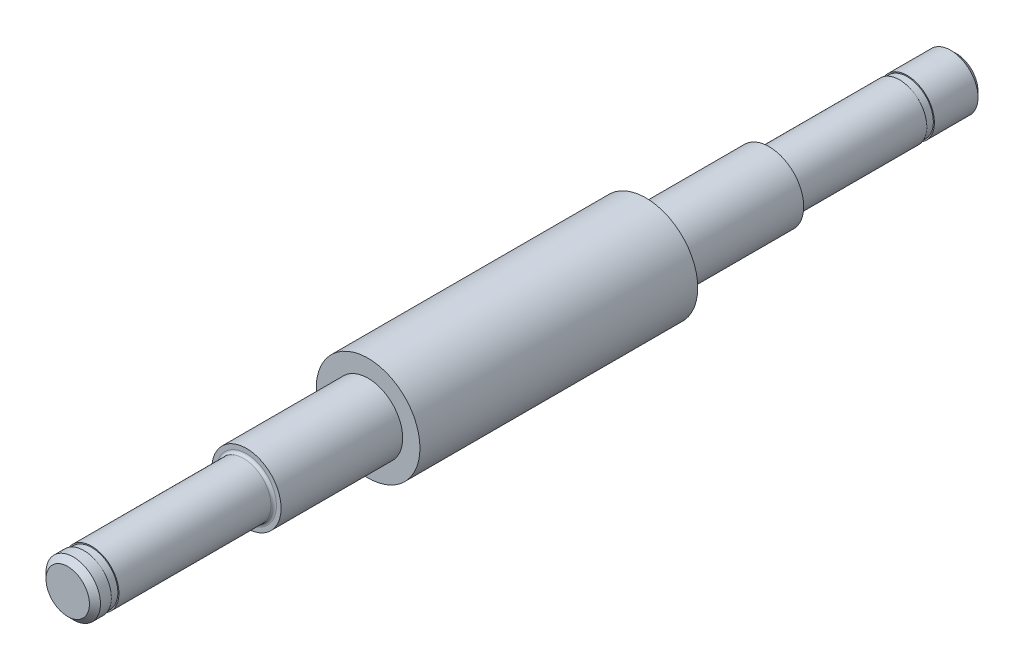
from build123d import *

# Parameters (mm, degrees)
SKETCH1_R                = 2.5
BOSS_EXTRUDE1_DEPTH      = 40.767
SKETCH2_W                = 0.7
SKETCH2_H                = 0.1
SKETCH5_R                = 3.175
BOSS_EXTRUDE3_DEPTH      = 47.9552
SKETCH7_W                = 0.7
SKETCH7_H                = 0.1
CHAMFER1_SIZE            = 0.508
FILLET1_R                = 0.254
BOSS_EXTRUDE4_DEPTH      = 13.208
BOSS_EXTRUDE4_DEPTH_BACK = 12.2809
SKETCH8_R                = 4.7625


with BuildPart() as part:
    # Sketch1 → Boss-Extrude1 (new, symmetric)
    with BuildSketch(Plane.XY):
        Circle(SKETCH1_R)
    extrude(amount=BOSS_EXTRUDE1_DEPTH, both=True)

    # Sketch2 → Cut-Revolve1 (revolve, cut)
    with BuildSketch(Plane(origin=(0, 0, 0), x_dir=(0, 0, -1), z_dir=(1, 0, 0))):
        with Locations((-38.914555436, 2.45)):
            Rectangle(SKETCH2_W, SKETCH2_H)
    revolve(axis=Axis((0, 0, 40.767), (0, 0, -1)), mode=Mode.SUBTRACT)

    # Sketch5 → Boss-Extrude3 (add)
    with BuildSketch(Plane(origin=(0, 0, 24.364555436), x_dir=(-1, 0, 0), z_dir=(0, 0, -1))):
        Circle(SKETCH5_R)
    extrude(amount=BOSS_EXTRUDE3_DEPTH)

    # Sketch7 → Cut-Revolve2 (revolve, cut)
    with BuildSketch(Plane(origin=(0, -92.71594082, 0), x_dir=(0, 0, 1), z_dir=(1, 0, 0))):
        with Locations((-35.912002714, -95.16594082)):
            Rectangle(SKETCH7_W, SKETCH7_H)
    revolve(axis=Axis((0, 0, -23.590644564), (0, 0, -1)), mode=Mode.SUBTRACT)

    # Chamfer1
    chamfer1_edges = [part.edges().sort_by_distance(p)[0] for p in [
        (-2.5, 0, 40.767),
        (-2.5, 0, -40.767),
    ]]
    chamfer(chamfer1_edges, length=CHAMFER1_SIZE)

    # Fillet1
    fillet1_edges = [part.edges().sort_by_distance(p)[0] for p in [
        (-2.5, 0, -23.590644564),
        (-2.5, 0, 24.364555436),
    ]]
    fillet(fillet1_edges, radius=FILLET1_R)

    # Sketch8 → Boss-Extrude4 (add, two sides: drawn at the far end of the back side and taken through both)
    with BuildSketch(Plane.XY.offset(-BOSS_EXTRUDE4_DEPTH_BACK)):
        Circle(SKETCH8_R)
    extrude(amount=BOSS_EXTRUDE4_DEPTH + BOSS_EXTRUDE4_DEPTH_BACK)


solid = part.part
